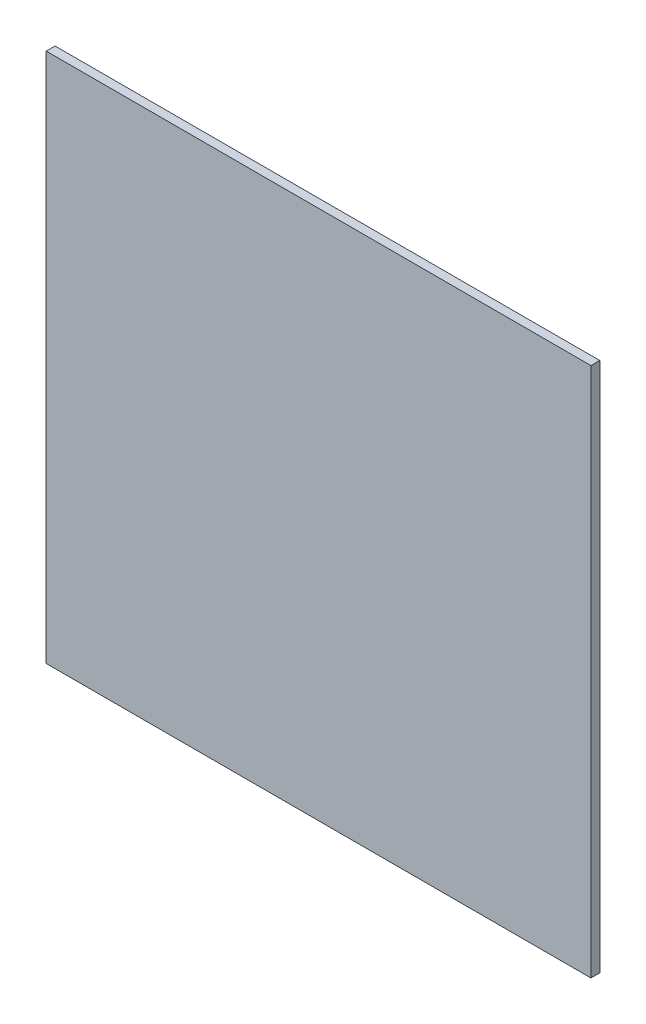
from build123d import *

# Parameters (mm, degrees)
SKETCH1_W           = 98.840202878
SKETCH1_H           = 96.237574857
BOSS_EXTRUDE1_DEPTH = 1.6


with BuildPart() as part:
    # Sketch1 → Boss-Extrude1 (new body)
    with BuildSketch(Plane.XY):
        with Locations((49.420101439, 48.118787429)):
            Rectangle(SKETCH1_W, SKETCH1_H)
    extrude(amount=BOSS_EXTRUDE1_DEPTH)


solid = part.part
